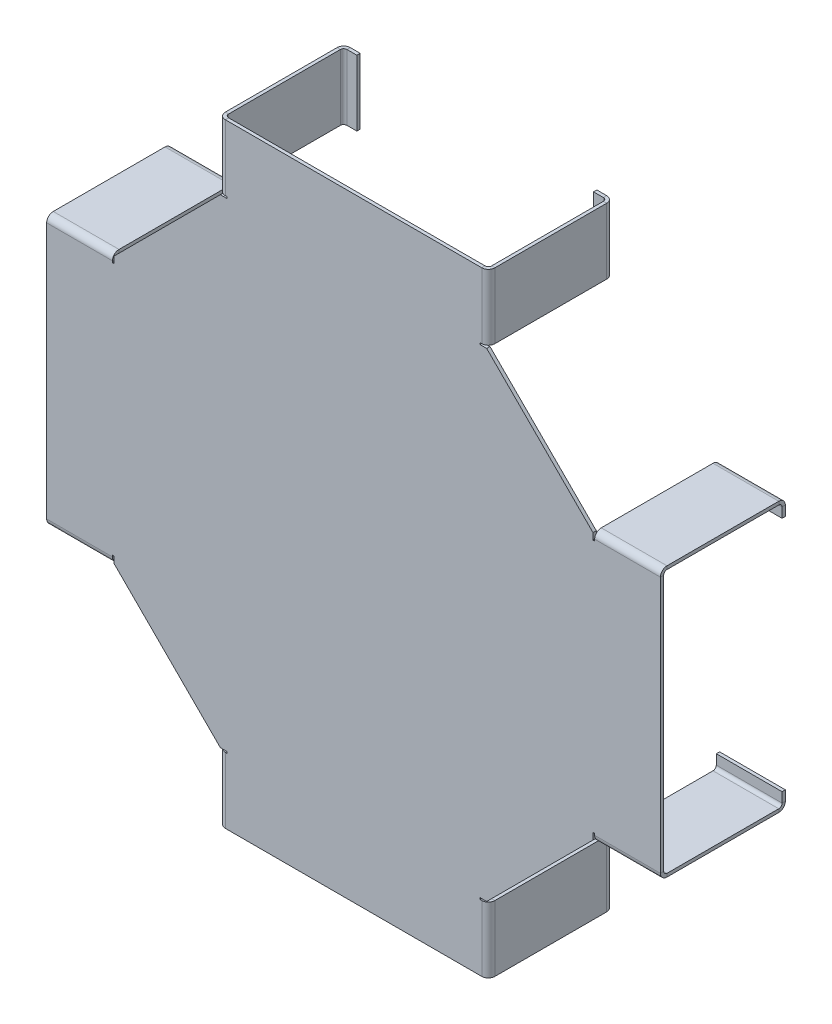
from build123d import *

# Parameters (mm, degrees)
SM_BASE_FLANGE_1_DEPTH            = 0.75
SM_EDGE_FLANGE_1_STRIP_W          = 4.5
SM_EDGE_FLANGE_1_STRIP_H          = 0.75
SM_EDGE_FLANGE_1_STRIP_CUT_DEPTH  = 15
SM_EDGE_FLANGE_1_RELIEF_W         = 4.875
SM_EDGE_FLANGE_1_RELIEF_H         = 0.375
SM_EDGE_FLANGE_1_RELIEF_CUT_DEPTH = 0.75
SM_EDGE_FLANGE_1_DEPTH            = 15
SM_EDGE_FLANGE_2_STRIP_W          = 4.5
SM_EDGE_FLANGE_2_STRIP_H          = 0.75
SM_EDGE_FLANGE_2_STRIP_CUT_DEPTH  = 15
SM_EDGE_FLANGE_2_DEPTH            = 15


# Sheet-metal steps are written as plain solids
with BuildPart() as part:
    # Sketch 1 → Базовая кромка1 (new body)
    with BuildSketch(Plane.XY):
        Polygon((-70, 0), (-70, 30), (-55, 30), (-42.5, 42.5), (0, 0), align=None)
    extrude(amount=-SM_BASE_FLANGE_1_DEPTH)

    # Ребро-кромка1 strip (across the edge) → Ребро-кромка1 strip cut (cut)
    with BuildSketch(Plane(origin=(-70, 30, -0.75), x_dir=(0, -1, 0), z_dir=(1, 0, 0))):
        with Locations((-1.5, -0.375)):
            Rectangle(SM_EDGE_FLANGE_1_STRIP_W, SM_EDGE_FLANGE_1_STRIP_H)
    extrude(amount=SM_EDGE_FLANGE_1_STRIP_CUT_DEPTH, mode=Mode.SUBTRACT)

    # Ребро-кромка1 relief (on the sheet) → Ребро-кромка1 relief cut (cut)
    with BuildSketch(Plane(origin=(-70, 29.25, -0.75), x_dir=(0, -1, 0), z_dir=(0, 0, -1))):
        with Locations((-2.0625, -15.1875)):
            Rectangle(SM_EDGE_FLANGE_1_RELIEF_W, SM_EDGE_FLANGE_1_RELIEF_H)
    extrude(amount=-SM_EDGE_FLANGE_1_RELIEF_CUT_DEPTH, mode=Mode.SUBTRACT)

    # Ребро-кромка1 section (across the edge) → Ребро-кромка1 (add)
    with BuildSketch(Plane(origin=(-70, 30, -0.75), x_dir=(0, -1, 0), z_dir=(1, 0, 0))):
        with BuildLine():
            Line((-0.75, 0.75), (-0.75, 27))
            Line((-0.75, 27), (0, 27))
            Line((0, 27), (0, 0.75))
            ThreePointArc((0, 0.75), (0.219669914, 0.219669914), (0.75, 0))
            Line((0.75, 0), (0.75, -0.75))
            ThreePointArc((0.75, -0.75), (-0.310660172, -0.310660172), (-0.75, 0.75))
        make_face()
    extrude(amount=SM_EDGE_FLANGE_1_DEPTH)

    # Ребро-кромка2 strip (across the edge) → Ребро-кромка2 strip cut (cut)
    with BuildSketch(Plane(origin=(-70, 30, -27.75), x_dir=(0, 0, 1), z_dir=(1, 0, 0))):
        with Locations((-1.5, -0.375)):
            Rectangle(SM_EDGE_FLANGE_2_STRIP_W, SM_EDGE_FLANGE_2_STRIP_H)
    extrude(amount=SM_EDGE_FLANGE_2_STRIP_CUT_DEPTH, mode=Mode.SUBTRACT)

    # Ребро-кромка2 section (across the edge) → Ребро-кромка2 (add)
    with BuildSketch(Plane(origin=(-70, 30, -27.75), x_dir=(0, 0, 1), z_dir=(1, 0, 0))):
        with BuildLine():
            Line((-0.75, 0.75), (-0.75, 3))
            Line((-0.75, 3), (0, 3))
            Line((0, 3), (0, 0.75))
            ThreePointArc((0, 0.75), (0.219669914, 0.219669914), (0.75, 0))
            Line((0.75, 0), (0.75, -0.75))
            ThreePointArc((0.75, -0.75), (-0.310660172, -0.310660172), (-0.75, 0.75))
        make_face()
    extrude(amount=SM_EDGE_FLANGE_2_DEPTH)

    # Зеркальное отражение1: part across plane


with BuildPart() as part_1:
    add(part.part)
    add(part.part.mirror(Plane(origin=(-70, 0, -0.75), x_dir=(0, 0, 1), z_dir=(0, -1, 0))))

    # Зеркальное отражение2: part across plane


with BuildPart() as part_2:
    add(part_1.part)
    add(part_1.part.mirror(Plane(origin=(0, 0, -0.75), x_dir=(0, 0, 1), z_dir=(0.707106781186558, -0.7071067811865371, 0))))

    # Зеркальное отражение3: part across face


with BuildPart() as part_3:
    add(part_2.part)
    add(part_2.part.mirror(Plane(origin=(0, 0, -0.375), x_dir=(0, 0, 1), z_dir=(0.7071067811865476, 0.7071067811865476, 0))))


solid = part_3.part
